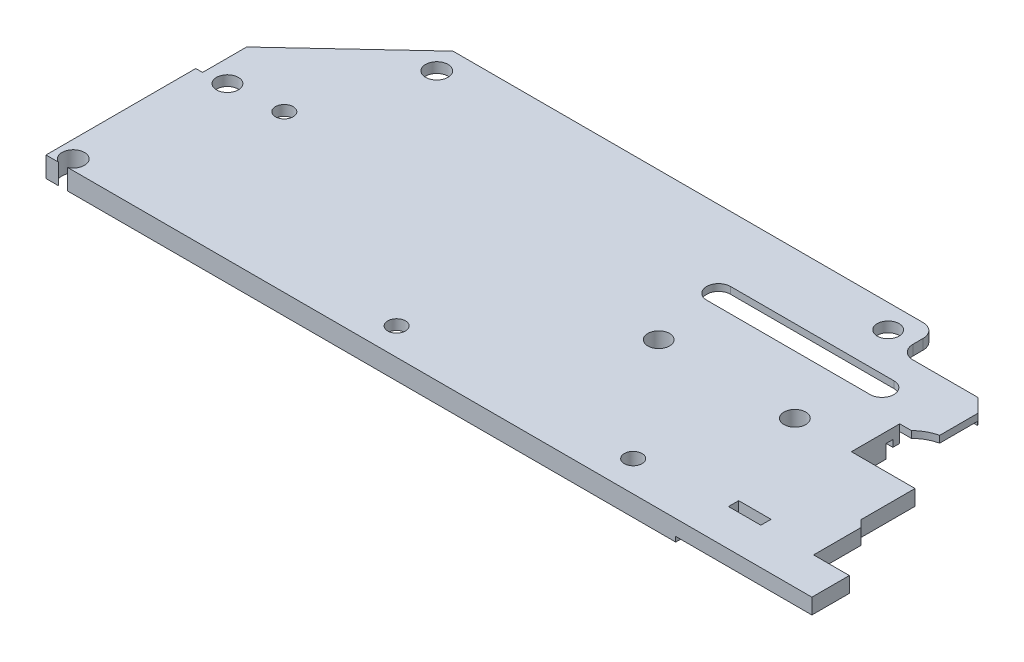
from build123d import *

# Parameters (mm, degrees)
SKETCH_1_W           = 30.5
SKETCH_1_H           = 8.5
SKETCH_1_R           = 1.6
EXTRUDE_1_DEPTH      = 3.5
SKETCH_2_W           = 30.5
SKETCH_2_H           = 18
EXTRUDE_2_DEPTH      = 3
SKETCH_3_W           = 30.5
SKETCH_3_H           = 16.6
EXTRUDE_3_DEPTH      = 1.5
EXTRUDE_4_DEPTH      = 57
SKETCH_5_W           = 43.1
SKETCH_5_H           = 1.5
EXTRUDE_5_DEPTH      = 2.5
CUT_EXTRUDE_1_DEPTH  = 67.219785563
SKETCH_7_W           = 57
SKETCH_7_H           = 1
CUT_EXTRUDE_2_DEPTH  = 1.5
SKETCH_8_W           = 18
SKETCH_8_H           = 3
EXTRUDE_6_DEPTH      = 16.5
SKETCH_9_W           = 20
SKETCH_9_H           = 10.4
CUT_EXTRUDE_3_DEPTH  = 0.725
CUT_EXTRUDE_4_REACH  = 68.166
SKETCH_10_W          = 4.75
SKETCH_10_H          = 1.5
SKETCH_11_W          = 15
SKETCH_11_H          = 7.6
CUT_EXTRUDE_5_DEPTH  = 0.725
SKETCH_12_W          = 8.5
SKETCH_12_H          = 3.5
EXTRUDE_7_DEPTH      = 1.5
CUT_EXTRUDE_6_REACH  = 68.22
EXTRUDE_8_REACH      = 68.22
SKETCH_15_W          = 7
SKETCH_15_H          = 3.4
EXTRUDE_9_DEPTH      = 2.275
SKETCH_16_W          = 3.5
SKETCH_16_H          = 1.5
EXTRUDE_10_DEPTH     = 2.275
CUT_EXTRUDE_7_REACH  = 68.166
SKETCH_17_W          = 5.25
SKETCH_17_H          = 15.9
CUT_EXTRUDE_8_DEPTH  = 0.725
CUT_EXTRUDE_9_REACH  = 68.166
SKETCH_19_W          = 1
SKETCH_19_H          = 8.9
CHAMFER_1_SIZE       = 1
CUT_EXTRUDE_10_REACH = 68.22
EXTRUDE_12_DEPTH     = 1
SKETCH_23_R          = 1.6
EXTRUDE_13_DEPTH     = 1.5
SKETCH_24_W          = 7.5
SKETCH_24_H          = 17
EXTRUDE_14_DEPTH     = 1.5
CHAMFER_2_SIZE       = 4.5
CHAMFER_2_SIZE2      = 3.452971446
CUT_EXTRUDE_11_REACH = 72.958
SKETCH_25_R          = 1.65
SKETCH_26_R          = 4
CUT_EXTRUDE_12_DEPTH = 1
FILLET_1_R           = 1
EXTRUDE_15_DEPTH     = 1
FILLET_2_R           = 1
FILLET_3_R           = 1
CUT_EXTRUDE_13_REACH = 72.9
SKETCH_28_W          = 7
SKETCH_28_H          = 4.2
EXTRUDE_16_DEPTH     = 1
FILLET_4_R           = 2
CUT_EXTRUDE_14_REACH = 72.9
SKETCH_30_R          = 1.6
SKETCH_31_R          = 3.75
CUT_EXTRUDE_15_DEPTH = 1
FILLET_5_R           = 1
CUT_EXTRUDE_16_REACH = 72.916
FILLET_7_R           = 2
EXTRUDE_17_DEPTH     = 3.5
EXTRUDE_18_DEPTH     = 0.9
SKETCH_35_W          = 37
SKETCH_35_H          = 7
CUT_EXTRUDE_17_DEPTH = 0.5
CHAMFER_3_SIZE       = 0.5
EXTRUDE_19_DEPTH     = 4.4
CUT_EXTRUDE_18_DEPTH = 71.958156684
CUT_EXTRUDE_19_REACH = 72.958
SKETCH_38_R          = 1.3
EXTRUDE_20_DEPTH     = 1
EXTRUDE_21_DEPTH     = 1
FILLET_8_R           = 1
FILLET_9_R           = 1
FILLET_10_R          = 1
SKETCH_41_W          = 1
SKETCH_41_H          = 22
EXTRUDE_22_DEPTH     = 1.5
EXTRUDE_23_REACH     = 73.887
CUT_EXTRUDE_20_REACH = 73.91
SKETCH_43_R          = 1.65
EXTRUDE_24_DEPTH     = 1.5
FILLET_11_R          = 1
CHAMFER_4_SIZE       = 2
CUT_EXTRUDE_21_REACH = 73.853
CUT_EXTRUDE_22_REACH = 73.887
SKETCH_46_R          = 1.3
CUT_EXTRUDE_START    = -1.5
SKETCH_47_R          = 3.6
CUT_EXTRUDE_24_DEPTH = 1.5


# Some blends are built 0.0001 mm under size
with BuildPart() as part:
    # 草图1 → 凸台-拉伸1 (new body)
    with BuildSketch(Plane(origin=(0, 0, 0), x_dir=(1, 0, 0), z_dir=(0, 1, 0))):
        with Locations((12.25, 0.75)):
            Rectangle(SKETCH_1_W, SKETCH_1_H)
        with Locations(Location((0, 0, 0), (0, 0, 270))):
            Circle(SKETCH_1_R, mode=Mode.SUBTRACT)
        with Locations(Location((20, 0, 0), (0, 0, 270))):
            Circle(SKETCH_1_R, mode=Mode.SUBTRACT)
    extrude(amount=EXTRUDE_1_DEPTH)

    # 草图2 → 凸台-拉伸2 (add)
    with BuildSketch(Plane(origin=(0, 3.5, 0), x_dir=(1, 0, 0), z_dir=(0, 1, 0))):
        with Locations((12.25, -12.5)):
            Rectangle(SKETCH_2_W, SKETCH_2_H)
    extrude(amount=-EXTRUDE_2_DEPTH)

    # 草图3 → 凸台-拉伸3 (add)
    with BuildSketch(Plane(origin=(0, 3.5, 0), x_dir=(1, 0, 0), z_dir=(0, 1, 0))):
        with Locations((12.25, 13.3)):
            Rectangle(SKETCH_3_W, SKETCH_3_H)
    extrude(amount=-EXTRUDE_3_DEPTH)

    # 草图4 → 凸台-拉伸4 (add)
    with BuildSketch(Plane.ZY.offset(3)):
        Polygon((3.5, 0.5), (-5, 0.5), (-5, 2), (-21.6, 2), (-21.6, 3.5), (21.5, 3.5), (21.5, 0.5), align=None)
    extrude(amount=EXTRUDE_4_DEPTH)

    # 草图5 → 凸台-拉伸5 (add)
    with BuildSketch(Plane.ZY.offset(60)):
        with Locations((-0.05, 2.75)):
            Rectangle(SKETCH_5_W, SKETCH_5_H)
    extrude(amount=EXTRUDE_5_DEPTH)

    # 草图6 → 切除-拉伸1 (cut, through all)
    with BuildSketch(Plane(origin=(0, 3.5, 0), x_dir=(1, 0, 0), z_dir=(0, 1, 0))):
        Polygon((-53.576057695, 21.6), (-62.5, 13.278289173), (-62.5, 21.6), align=None)
    extrude(amount=-CUT_EXTRUDE_1_DEPTH, mode=Mode.SUBTRACT)

    # 草图7 → 切除-拉伸2 (cut)
    with BuildSketch(Plane.XZ.offset(-0.5)):
        with Locations((-31.5, -4.5)):
            Rectangle(SKETCH_7_W, SKETCH_7_H)
    extrude(amount=-CUT_EXTRUDE_2_DEPTH, mode=Mode.SUBTRACT)

    # 草图8 → 凸台-拉伸6 (add)
    with BuildSketch(Plane(origin=(27.5, 0, 0), x_dir=(0, 0, -1), z_dir=(1, 0, 0))):
        with Locations((-12.5, 2)):
            Rectangle(SKETCH_8_W, SKETCH_8_H)
    extrude(amount=EXTRUDE_6_DEPTH)

    # 草图9 → 切除-拉伸3 (cut)
    with BuildSketch(Plane.XZ.offset(-0.5)):
        with Locations((34, 16.3)):
            Rectangle(SKETCH_9_W, SKETCH_9_H)
    extrude(amount=-CUT_EXTRUDE_3_DEPTH, mode=Mode.SUBTRACT)

    # 草图10 → 切除-拉伸4 (cut, up to next)
    with BuildSketch(Plane.XZ.offset(-1.225), mode=Mode.PRIVATE) as cut_extrude_4_sk1:
        with Locations((28.725, 15.35)):
            Rectangle(SKETCH_10_W, SKETCH_10_H)
    cut_extrude_4_tool1 = extrude(cut_extrude_4_sk1.sketch, amount=-CUT_EXTRUDE_4_REACH, mode=Mode.PRIVATE) & part.part
    add(cut_extrude_4_tool1.solids().sort_by_distance((28.725, 1.225, 15.35))[0], mode=Mode.SUBTRACT)

    # 草图11 → 切除-拉伸5 (cut)
    with BuildSketch(Plane.XZ.offset(-0.5)):
        with Locations((36.5, 7.3)):
            Rectangle(SKETCH_11_W, SKETCH_11_H)
    extrude(amount=-CUT_EXTRUDE_5_DEPTH, mode=Mode.SUBTRACT)

    # 草图12 → 凸台-拉伸7 (add)
    with BuildSketch(Plane(origin=(27.5, 0, 0), x_dir=(0, 0, -1), z_dir=(1, 0, 0))):
        with Locations((0.75, 1.75)):
            Rectangle(SKETCH_12_W, SKETCH_12_H)
    extrude(amount=EXTRUDE_7_DEPTH)

    # 草图13 → 切除-拉伸6 (cut, up to next)
    with BuildSketch(Plane.XZ, mode=Mode.PRIVATE) as cut_extrude_6_sk1:
        Polygon((27.5, -5), (29, 3.5), (29, -5), align=None)
    cut_extrude_6_tool1 = extrude(cut_extrude_6_sk1.sketch, amount=-CUT_EXTRUDE_6_REACH, mode=Mode.PRIVATE) & part.part
    add(cut_extrude_6_tool1.solids().sort_by_distance((28.5, 0, -2.166667))[0], mode=Mode.SUBTRACT)

    # 凸台-拉伸8: up to this face of the body (flat: up to its plane)
    extrude_8_end = Plane(part.part.faces().sort_by_distance((12.7973967, 0, -0.762152221))[0])
    # 草图14 → 凸台-拉伸8 (add, up to the picked face)
    with BuildSketch(Plane(origin=(0, 3.5, 0), x_dir=(1, 0, 0), z_dir=(0, 1, 0)), mode=Mode.PRIVATE) as extrude_8_sk1:
        Polygon((28.4, -0.1), (29, -3.5), (33.5, -3.5), (33.5, -0.1), align=None)
    extrude_8_tool1 = split(extrude(extrude_8_sk1.sketch, amount=-EXTRUDE_8_REACH, mode=Mode.PRIVATE), bisect_by=extrude_8_end, keep=Keep.BOTH, mode=Mode.PRIVATE)
    add(extrude_8_tool1.solids().sort_by(Axis((31.096875, 3.5, 1.764583), (0, -1, 0)))[0])

    # 草图15 → 凸台-拉伸9 (add)
    with BuildSketch(Plane(origin=(0, 3.5, 0), x_dir=(1, 0, 0), z_dir=(0, 1, 0))):
        with Locations((37, -1.8)):
            Rectangle(SKETCH_15_W, SKETCH_15_H)
    extrude(amount=-EXTRUDE_9_DEPTH)

    # 草图16 → 凸台-拉伸10 (add)
    with BuildSketch(Plane(origin=(0, 3.5, 0), x_dir=(1, 0, 0), z_dir=(0, 1, 0))):
        with Locations((42.25, -2.75)):
            Rectangle(SKETCH_16_W, SKETCH_16_H)
    extrude(amount=-EXTRUDE_10_DEPTH)

    # 草图17 → 切除-拉伸7 (cut, up to next)
    with BuildSketch(Plane.XZ.offset(-1.225), mode=Mode.PRIVATE) as cut_extrude_7_sk1:
        with Locations((41.375, 8.05)):
            Rectangle(SKETCH_17_W, SKETCH_17_H)
    cut_extrude_7_tool1 = extrude(cut_extrude_7_sk1.sketch, amount=-CUT_EXTRUDE_7_REACH, mode=Mode.PRIVATE) & part.part
    add(cut_extrude_7_tool1.solids().sort_by_distance((41.375, 1.225, 8.05))[0], mode=Mode.SUBTRACT)

    # 草图18 → 切除-拉伸8 (cut)
    with BuildSketch(Plane.XZ.offset(-0.5)):
        Polygon((24, 11.1), (29, 6.1), (29, 11.1), align=None)
    extrude(amount=-CUT_EXTRUDE_8_DEPTH, mode=Mode.SUBTRACT)

    # 草图19 → 切除-拉伸9 (cut, up to next)
    with BuildSketch(Plane.XZ.offset(-1.225), mode=Mode.PRIVATE) as cut_extrude_9_sk1:
        with Locations((38.25, 4.55)):
            Rectangle(SKETCH_19_W, SKETCH_19_H)
    cut_extrude_9_tool1 = extrude(cut_extrude_9_sk1.sketch, amount=-CUT_EXTRUDE_9_REACH, mode=Mode.PRIVATE) & part.part
    add(cut_extrude_9_tool1.solids().sort_by_distance((38.25, 1.225, 4.55))[0], mode=Mode.SUBTRACT)

    # 倒角1
    chamfer_1_edges = [part.edges().sort_by_distance(p)[0] for p in [
        (37.75, 2.3625, 9),
    ]]
    chamfer(chamfer_1_edges, length=CHAMFER_1_SIZE - 0.0001)  # a hair under: the kernel refuses the full size

    # 草图20 → 切除-拉伸10 (cut, up to next)
    with BuildSketch(Plane(origin=(0, 3.5, 0), x_dir=(1, 0, 0), z_dir=(0, 1, 0)), mode=Mode.PRIVATE) as cut_extrude_10_sk1:
        with BuildLine():
            Line((-1.5, 12.05), (22.5, 12.05))
            ThreePointArc((22.5, 12.05), (24.25, 10.3), (22.5, 8.55))
            Line((22.5, 8.55), (-1.5, 8.55))
            ThreePointArc((-1.5, 8.55), (-3.25, 10.3), (-1.5, 12.05))
        make_face()
    cut_extrude_10_tool1 = extrude(cut_extrude_10_sk1.sketch, amount=-CUT_EXTRUDE_10_REACH, mode=Mode.PRIVATE) & part.part
    add(cut_extrude_10_tool1.solids().sort_by_distance((10.5, 3.5, -10.3))[0], mode=Mode.SUBTRACT)

    # 草图22 → 凸台-拉伸12 (add)
    with BuildSketch(Plane.XZ.offset(-2)):
        Polygon((-51.136152139, -18.405938895), (16.75, -18.405938895), (16.75, -19.405938895), (-51.530062615, -19.405938895), (-52.602431325, -18.405938895), (-60, -11.507594505), (-60, -6), (-59, -6), (27.5, -6), (27.5, -7), (-59, -7), (-59, -11.07278213), align=None)
    extrude(amount=EXTRUDE_12_DEPTH)

    # 草图23 → 凸台-拉伸13 (add)
    with BuildSketch(Plane(origin=(0, 3.5, 0), x_dir=(1, 0, 0), z_dir=(0, 1, 0))):
        Polygon((-62.5, 13.278289173), (-67.5, 8.615713742), (-67.5, -21.5), (-62.5, -21.5), align=None)
        with Locations(Location((-64.25, 0.9, 0), (0, 0, 270))):
            Circle(SKETCH_23_R, mode=Mode.SUBTRACT)
    extrude(amount=-EXTRUDE_13_DEPTH)

    # 草图24 → 凸台-拉伸14 (add)
    with BuildSketch(Plane.XZ.offset(-2)):
        with Locations((-63.75, 13)):
            Rectangle(SKETCH_24_W, SKETCH_24_H)
    extrude(amount=EXTRUDE_14_DEPTH)

    # 倒角2
    chamfer_2_edges = [part.edges().sort_by_distance(p)[0] for p in [
        (-60, 1.25, 4.5),
    ]]
    chamfer_2_side = [part.faces().sort_by_distance(p)[0] for p in [
        (-63.75, 1.25, 4.5),
    ]]
    chamfer(chamfer_2_edges, length=CHAMFER_2_SIZE, length2=CHAMFER_2_SIZE2, reference=chamfer_2_side[0])

    # 草图25 → 切除-拉伸11 (cut, up to next)
    with BuildSketch(Plane(origin=(0, 3.5, 0), x_dir=(1, 0, 0), z_dir=(0, 1, 0)), mode=Mode.PRIVATE) as cut_extrude_11_sk1:
        with Locations(Location((-50.5, 17.9, 0), (0, 0, 270))):
            Circle(SKETCH_25_R)
    cut_extrude_11_tool1 = extrude(cut_extrude_11_sk1.sketch, amount=-CUT_EXTRUDE_11_REACH, mode=Mode.PRIVATE) & part.part
    add(cut_extrude_11_tool1.solids().sort_by_distance((-50.5, 3.5, -17.9))[0], mode=Mode.SUBTRACT)

    # 草图26 → 切除-拉伸12 (cut)
    with BuildSketch(Plane.XZ.offset(-2)):
        with Locations((-50.5, -17.9)):
            Circle(SKETCH_26_R)
    extrude(amount=CUT_EXTRUDE_12_DEPTH, mode=Mode.SUBTRACT)

    # 圆角1
    # the kernel refuses this fillet: 1 mm, written as the material it takes off along each edge
    with BuildSketch(Plane(origin=(-46.794308696, -2.155457292, -19.405938895), x_dir=(1, 0, 0), z_dir=(0, 1, 0))) as fillet_1_piece_1:
        with BuildLine():
            CenterArc((1.262182917, -1), FILLET_1_R, 90, 90)
            ThreePointArc((0.262182917, -1), (0.163533678, -0.491494204), (0, 0))
            Line((0, 0), (1.262182917, 0))
        make_face()
    extrude(amount=4.155457292, mode=Mode.SUBTRACT)
    with BuildSketch(Plane(origin=(-54.341288761, -2.370579134, -16.784428104), x_dir=(0.40354953180245684, 0, 0.9149577997820545), z_dir=(0, 1, 0))) as fillet_1_piece_2:
        with BuildLine():
            CenterArc((1.387760422, -0.944377893), FILLET_1_R, 109.199734771, 90)
            Line((0.443382529, -1.273240168), (0, 0))
            ThreePointArc((0, 0), (0.529449073, -0.035194371), (1.058898146, 0))
        make_face()
    extrude(amount=4.370579134, mode=Mode.SUBTRACT)

    # 草图27 → 凸台-拉伸15 (add)
    with BuildSketch(Plane.XZ.offset(-2)):
        with BuildLine():
            Line((-53.91397091, -15.815580985), (-54.657439344, -15.122285454))
            ThreePointArc((-54.657439344, -15.122285454), (-48.808129641, -13.194941585), (-45.525663277, -18.405938895))
            Line((-45.525663277, -18.405938895), (-46.532125779, -18.405938895))
            ThreePointArc((-46.532125779, -18.405938895), (-49.175541339, -14.125637901), (-53.91397091, -15.815580985))
        make_face()
    extrude(amount=EXTRUDE_15_DEPTH)

    # 圆角2
    fillet_2_edges = [part.edges().sort_by_distance(p)[0] for p in [
        (-60, 1.5, -11.507594505),
        (-59, 1.5, -11.07278213),
        (-45.525663277, 1.5, -18.405938895),
        (-54.657439344, 1.5, -15.122285454),
    ]]
    fillet(fillet_2_edges, radius=FILLET_2_R)

    # 圆角3
    fillet_3_edges = [part.edges().sort_by_distance(p)[0] for p in [
        (-60, 1.25, -4),
        (-60, 1.5, -6),
        (-59, 1.5, -7),
    ]]
    fillet(fillet_3_edges, radius=FILLET_3_R)

    # 草图28 → 切除-拉伸13 (cut, up to next)
    with BuildSketch(Plane.XZ.offset(-2), mode=Mode.PRIVATE) as cut_extrude_13_sk1:
        with Locations((24, -19.5)):
            Rectangle(SKETCH_28_W, SKETCH_28_H)
    cut_extrude_13_tool1 = extrude(cut_extrude_13_sk1.sketch, amount=-CUT_EXTRUDE_13_REACH, mode=Mode.PRIVATE) & part.part
    add(cut_extrude_13_tool1.solids().sort_by_distance((24, 2, -19.5))[0], mode=Mode.SUBTRACT)

    # 草图29 → 凸台-拉伸16 (add)
    with BuildSketch(Plane.XZ.offset(-2)):
        Polygon((20.5, -21.6), (19.25, -21.6), (19.25, -16.1), (27.5, -16.1), (27.5, -17.4), (20.5, -17.4), align=None)
    extrude(amount=EXTRUDE_16_DEPTH)

    # 圆角4
    fillet_4_edges = [part.edges().sort_by_distance(p)[0] for p in [
        (20.5, 2.25, -17.4),
        (19.25, 1.5, -16.1),
    ]]
    fillet(fillet_4_edges, radius=FILLET_4_R)

    # 草图30 → 切除-拉伸14 (cut, up to next)
    with BuildSketch(Plane.XZ.offset(-2), mode=Mode.PRIVATE) as cut_extrude_14_sk1:
        with Locations(Location((15.6, -18.1, 0), (0, 0, 234.707359673))):
            Circle(SKETCH_30_R)
    cut_extrude_14_tool1 = extrude(cut_extrude_14_sk1.sketch, amount=-CUT_EXTRUDE_14_REACH, mode=Mode.PRIVATE) & part.part
    add(cut_extrude_14_tool1.solids().sort_by_distance((15.6, 2, -18.1))[0], mode=Mode.SUBTRACT)

    # 草图31 → 切除-拉伸15 (cut)
    with BuildSketch(Plane.XZ.offset(-2)):
        with Locations((15.6, -18.1)):
            Circle(SKETCH_31_R)
    extrude(amount=CUT_EXTRUDE_15_DEPTH, mode=Mode.SUBTRACT)

    # 圆角5
    # the kernel refuses this fillet: 1 mm, written as the material it takes off along each edge
    with BuildSketch(Plane(origin=(12.084744163, -2.055608782, -19.405938895), x_dir=(-0.21695026321218436, 0, 0.9761826587745575), z_dir=(0, 1, 0))) as fillet_5_piece_1:
        with BuildLine():
            CenterArc((1.241348711, -0.976182659), FILLET_5_R, 102.529970159, 90)
            Line((0.265166052, -1.193132922), (0, 0))
            ThreePointArc((0, 0), (0.512199224, -0.035144423), (1.024398447, 0))
        make_face()
    extrude(amount=4.055608782, mode=Mode.SUBTRACT)

    # 草图32 → 切除-拉伸16 (cut, up to next)
    with BuildSketch(Plane.XZ.offset(-1), mode=Mode.PRIVATE) as cut_extrude_16_sk1:
        with BuildLine():
            Line((19.25, -18.960232527), (19.25, -18.1))
            ThreePointArc((19.25, -18.1), (19.835786438, -16.685786438), (21.25, -16.1))
            Line((21.25, -16.1), (27.5, -16.1))
            Line((27.5, -16.1), (27.5, -17.4))
            Line((27.5, -17.4), (22.5, -17.4))
            ThreePointArc((22.5, -17.4), (21.085786438, -17.985786438), (20.5, -19.4))
            Line((20.5, -19.4), (20.5, -21.6))
            Line((20.5, -21.6), (19.25, -21.6))
            Line((19.25, -21.6), (19.25, -18.960232527))
        make_face()
    cut_extrude_16_tool1 = extrude(cut_extrude_16_sk1.sketch, amount=-CUT_EXTRUDE_16_REACH, mode=Mode.PRIVATE) & part.part
    add(cut_extrude_16_tool1.solids().sort_by_distance((19.349153, 1, -18.530116))[0], mode=Mode.SUBTRACT)

    # 圆角7
    fillet_7_edges = [part.edges().sort_by_distance(p)[0] for p in [
        (19.25, 2.75, -21.6),
    ]]
    fillet(fillet_7_edges, radius=FILLET_7_R)

    # 草图33 → 凸台-拉伸17 (add)
    with BuildSketch(Plane.XZ):
        Polygon((28.4, 0.1), (27.5, -5), (28.4, -5), align=None)
    extrude(amount=-EXTRUDE_17_DEPTH)

    # 草图34 → 凸台-拉伸18 (add)
    with BuildSketch(Plane(origin=(27.5, 0, 0), x_dir=(0, 0, -1), z_dir=(1, 0, 0))):
        Polygon((7, 2), (16.1, 2), (16.1, 3.5), (5, 3.5), (5, 2), (6, 2), (6, 1), (7, 1), align=None)
    extrude(amount=EXTRUDE_18_DEPTH)

    # 草图35 → 切除-拉伸17 (cut)
    with BuildSketch(Plane.XZ.offset(-2)):
        with Locations((9.9, -10.5)):
            Rectangle(SKETCH_35_W, SKETCH_35_H)
    extrude(amount=-CUT_EXTRUDE_17_DEPTH, mode=Mode.SUBTRACT)

    # 倒角3
    chamfer_3_edges = [part.edges().sort_by_distance(p)[0] for p in [
        (-8.6, 2, -10.5),
    ]]
    chamfer(chamfer_3_edges, length=CHAMFER_3_SIZE - 0.0001)  # a hair under: the kernel refuses the full size

    # 草图36 → 凸台-拉伸19 (add)
    with BuildSketch(Plane(origin=(28.4, 0, 0), x_dir=(0, 0, -1), z_dir=(1, 0, 0))):
        Polygon((16.1, 2), (16.1, 3.5), (7, 3.5), (7, 2.5), (14, 2.5), (14, 2), align=None)
    extrude(amount=EXTRUDE_19_DEPTH)

    # 草图37 → 切除-拉伸18 (cut, through all)
    with BuildSketch(Plane(origin=(0, 3.5, 0), x_dir=(1, 0, 0), z_dir=(0, 1, 0))):
        with BuildLine():
            Line((30.121856114, 7), (32.8, 7))
            Line((32.8, 7), (32.8, 8.46749476))
            ThreePointArc((32.8, 8.46749476), (31.35703357, 7.923352408), (30.121856114, 7))
        make_face()
    extrude(amount=-CUT_EXTRUDE_18_DEPTH, mode=Mode.SUBTRACT)

    # 草图38 → 切除-拉伸19 (cut, up to next)
    with BuildSketch(Plane(origin=(0, 3.5, 0), x_dir=(1, 0, 0), z_dir=(0, 1, 0)), mode=Mode.PRIVATE) as cut_extrude_19_sk1:
        with Locations(Location((13.25, -17, 0), (0, 0, 270))):
            Circle(SKETCH_38_R)
    cut_extrude_19_tool1 = extrude(cut_extrude_19_sk1.sketch, amount=-CUT_EXTRUDE_19_REACH, mode=Mode.PRIVATE) & part.part
    add(cut_extrude_19_tool1.solids().sort_by_distance((13.25, 3.5, 17))[0], mode=Mode.SUBTRACT)

    # 草图39 → 凸台-拉伸20 (add)
    with BuildSketch(Plane.XZ.offset(-2)):
        with BuildLine():
            Line((12.804915028, -15.6), (-46.743672006, -15.6))
            Line((-46.743672006, -15.6), (-46.743672006, -14.6))
            Line((-46.743672006, -14.6), (14.253708798, -14.6))
            ThreePointArc((14.253708798, -14.6), (13.469800678, -15.013780493), (12.804915028, -15.6))
        make_face()
    extrude(amount=EXTRUDE_20_DEPTH)

    # 草图40 → 凸台-拉伸21 (add)
    with BuildSketch(Plane.XZ.offset(-2)):
        with BuildLine():
            Line((11.561126395, -15.6), (12.804915028, -15.6))
            ThreePointArc((12.804915028, -15.6), (12.045145889, -16.906051824), (11.86250065, -18.405938895))
            Line((11.86250065, -18.405938895), (10.859862724, -18.405938895))
            ThreePointArc((10.859862724, -18.405938895), (10.991737715, -16.94829747), (11.561126395, -15.6))
        make_face()
    extrude(amount=EXTRUDE_21_DEPTH)

    # 圆角8
    fillet_8_edges = [part.edges().sort_by_distance(p)[0] for p in [
        (11.561126395, 1.5, -15.6),
        (10.859862724, 1.5, -18.405938895),
    ]]
    fillet(fillet_8_edges, radius=FILLET_8_R)

    # 圆角9
    fillet_9_edges = [part.edges().sort_by_distance(p)[0] for p in [
        (14.253708798, 1.5, -14.6),
    ]]
    fillet(fillet_9_edges, radius=FILLET_9_R)

    # 圆角10
    fillet_10_edges = [part.edges().sort_by_distance(p)[0] for p in [
        (-46.060405424, 1.5, -15.6),
        (-46.743672006, 1.5, -14.6),
    ]]
    fillet(fillet_10_edges, radius=FILLET_10_R)

    # 草图41 → 凸台-拉伸22 (add)
    with BuildSketch(Plane(origin=(0, 3.5, 0), x_dir=(1, 0, 0), z_dir=(0, 1, 0))):
        with Locations((-68, -10.5)):
            Rectangle(SKETCH_41_W, SKETCH_41_H)
    extrude(amount=-EXTRUDE_22_DEPTH)

    # 草图42 → 凸台-拉伸23 (add, up to next)
    with BuildSketch(Plane.XZ.offset(-0.5), mode=Mode.PRIVATE) as extrude_23_sk1:
        Polygon((-67.5, 4.5), (-67.5, 3), (-62.545161941, 3), (-64.5, 4.5), align=None)
    extrude_23_tool1 = extrude(extrude_23_sk1.sketch, amount=-EXTRUDE_23_REACH, mode=Mode.PRIVATE) - part.part
    add(extrude_23_tool1.solids().sort_by_distance((-65.471258, 0.5, 3.688564))[0])

    # 草图43 → 切除-拉伸20 (cut, up to next)
    with BuildSketch(Plane(origin=(0, 3.5, 0), x_dir=(1, 0, 0), z_dir=(0, 1, 0)), mode=Mode.PRIVATE) as cut_extrude_20_sk1:
        with Locations((-66, -20)):
            Circle(SKETCH_43_R)
    cut_extrude_20_tool1 = extrude(cut_extrude_20_sk1.sketch, amount=-CUT_EXTRUDE_20_REACH, mode=Mode.PRIVATE) & part.part
    add(cut_extrude_20_tool1.solids().sort_by_distance((-66, 3.5, 20))[0], mode=Mode.SUBTRACT)

    # 草图44 → 凸台-拉伸24 (add)
    with BuildSketch(Plane.XZ.offset(-2)):
        with BuildLine():
            Line((-67.5, 21.5), (-68.5, 21.5))
            Line((-68.5, 21.5), (-68.5, 18))
            Line((-68.5, 18), (-67.5, 18))
            Line((-67.5, 18), (-67.5, 19.312613646))
            ThreePointArc((-67.5, 19.312613646), (-67.65, 20), (-67.5, 20.687386354))
            Line((-67.5, 20.687386354), (-67.5, 21.5))
        make_face()
    extrude(amount=EXTRUDE_24_DEPTH)

    # 圆角11
    fillet_11_edges = [part.edges().sort_by_distance(p)[0] for p in [
        (-67.5, 1.25, 18),
    ]]
    fillet(fillet_11_edges, radius=FILLET_11_R - 0.0001)  # a hair under: the kernel refuses the full size

    # 倒角4
    chamfer_4_edges = [part.edges().sort_by_distance(p)[0] for p in [
        (32.8, 2.75, -16.1),
    ]]
    chamfer(chamfer_4_edges, length=CHAMFER_4_SIZE)

    # 草图45 → 切除-拉伸21 (cut, up to next)
    with BuildSketch(Plane.XZ.offset(-2), mode=Mode.PRIVATE) as cut_extrude_21_sk1:
        Polygon((-67.5, -8.615713742), (-53.576057695, -21.6), (-51.816522673, -21.6), (-52.757659663, -20.722375558), (-66.681601968, -7.7380893), (-67.5, -6.974920789), align=None)
    cut_extrude_21_tool1 = extrude(cut_extrude_21_sk1.sketch, amount=-CUT_EXTRUDE_21_REACH, mode=Mode.PRIVATE) & part.part
    add(cut_extrude_21_tool1.solids().sort_by_distance((-60.089431, 2, -14.689533))[0], mode=Mode.SUBTRACT)

    # 草图46 → 切除-拉伸22 (cut, up to next)
    with BuildSketch(Plane.XZ.offset(-0.5), mode=Mode.PRIVATE) as cut_extrude_22_sk1:
        with Locations(Location((-56.5, -1.5, 0), (0, 0, 270))):
            Circle(SKETCH_46_R)
    cut_extrude_22_tool1 = extrude(cut_extrude_22_sk1.sketch, amount=-CUT_EXTRUDE_22_REACH, mode=Mode.PRIVATE) & part.part
    # 草图46 → 切除-拉伸22 (cut, up to next)
    with BuildSketch(Plane.XZ.offset(-0.5), mode=Mode.PRIVATE) as cut_extrude_22_sk2:
        with Locations(Location((-21, 17.5, 0), (0, 0, 270))):
            Circle(SKETCH_46_R)
    cut_extrude_22_tool2 = extrude(cut_extrude_22_sk2.sketch, amount=-CUT_EXTRUDE_22_REACH, mode=Mode.PRIVATE) & part.part
    add(cut_extrude_22_tool1.solids().sort_by_distance((-56.5, 0.5, -1.5))[0], mode=Mode.SUBTRACT)
    add(cut_extrude_22_tool2.solids().sort_by_distance((-21, 0.5, 17.5))[0], mode=Mode.SUBTRACT)

    # 草图47 → 切除-拉伸24 (cut)
    with BuildSketch(Plane.XZ.offset(-0.5).offset(CUT_EXTRUDE_START)):
        with Locations(Location((-21, 17.5, 0), (0, 0, 270))):
            Circle(SKETCH_47_R)
        with BuildLine():
            Line((-60, -3), (-60, -0.657385023))
            ThreePointArc((-60, -0.657385023), (-53.025508104, -0.557712323), (-59.094696274, -3.995506211))
            ThreePointArc((-59.094696274, -3.995506211), (-59.739829803, -3.672794072), (-60, -3))
        make_face()
    extrude(amount=CUT_EXTRUDE_24_DEPTH, mode=Mode.SUBTRACT)


solid = part.part
